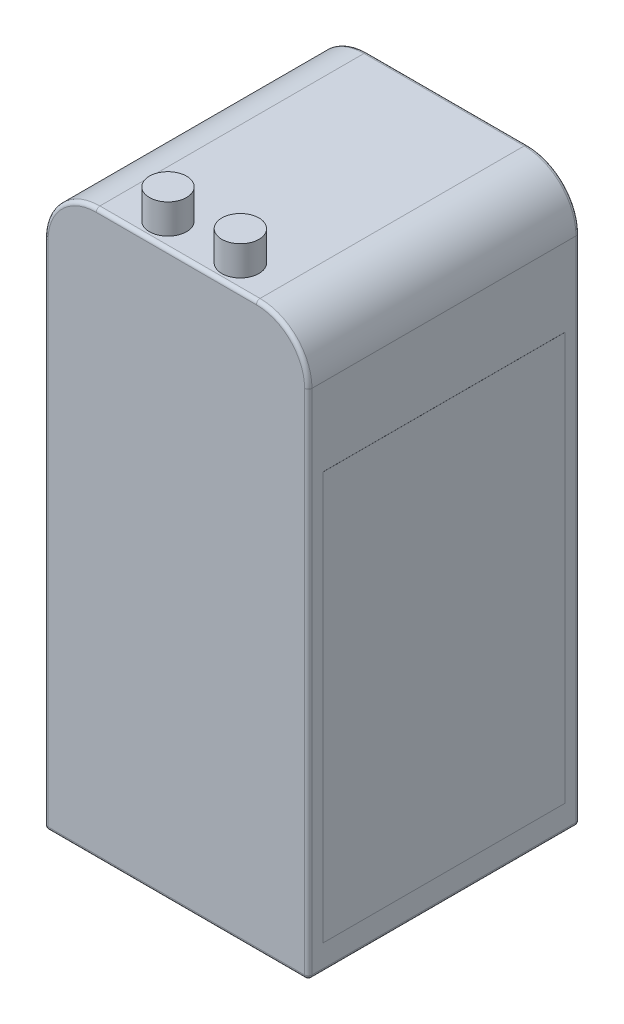
from build123d import *

# Parameters (mm, degrees)
SKETCH1_W             = 35.6
SKETCH1_H             = 36.6
BOSS_EXTRUDE1_DEPTH   = 76
SKETCH2_R             = 2.5
BOSS_EXTRUDE2_DEPTH   = 4
BOSS_EXTRUDE2_2_DEPTH = 4
FILLET1_R             = 7
FILLET2_R             = 0.5
SKETCH3_W             = 32.6
SKETCH3_H             = 55
BOSS_EXTRUDE3_DEPTH   = 0.01


with BuildPart() as part:
    # Sketch1 → Boss-Extrude1 (new body)
    with BuildSketch(Plane(origin=(0, 0, 0), x_dir=(1, 0, 0), z_dir=(0, 1, 0))):
        with Locations((17.8, 18.3)):
            Rectangle(SKETCH1_W, SKETCH1_H)
    extrude(amount=BOSS_EXTRUDE1_DEPTH)

    # Fillet1
    fillet1_edges = [part.edges().sort_by_distance(p)[0] for p in [
        (0, 76, -18.3),
        (35.6, 76, -18.3),
    ]]
    fillet(fillet1_edges, radius=FILLET1_R)

    # Fillet2
    fillet2_edges = [part.edges().sort_by_distance(p)[0] for p in [
        (33.549747468, 73.949747468, 0),
        (35.6, 34.5, 0),
        (17.8, 0, 0),
        (0, 34.5, 0),
        (2.050252532, 73.949747468, 0),
        (17.8, 76, 0),
        (17.8, 0, -36.6),
        (35.6, 34.5, -36.6),
        (33.549747468, 73.949747468, -36.6),
        (17.8, 76, -36.6),
        (2.050252532, 73.949747468, -36.6),
        (0, 34.5, -36.6),
        (0, 0, -18.3),
        (35.6, 0, -18.3),
    ]]
    fillet(fillet2_edges, radius=FILLET2_R)

    # Sketch3 → Boss-Extrude3 (add)
    with BuildSketch(Plane(origin=(35.6, 0, 0), x_dir=(0, 0, -1), z_dir=(1, 0, 0))):
        with Locations((18.3, 31)):
            Rectangle(SKETCH3_W, SKETCH3_H)
    extrude(amount=BOSS_EXTRUDE3_DEPTH)


with BuildPart() as body_2:
    # Sketch2 → Boss-Extrude2 (new body)
    with BuildSketch(Plane(origin=(0, 76, 0), x_dir=(1, 0, 0), z_dir=(0, 1, 0))):
        with Locations((13.354835188, 3.323329695)):
            Circle(SKETCH2_R)
    extrude(amount=BOSS_EXTRUDE2_DEPTH)


with BuildPart() as body_3:
    # Sketch2 → Boss-Extrude2 2 (new body)
    with BuildSketch(Plane(origin=(0, 76, 0), x_dir=(1, 0, 0), z_dir=(0, 1, 0))):
        with Locations((23.120727578, 3.323329695)):
            Circle(SKETCH2_R)
    extrude(amount=BOSS_EXTRUDE2_2_DEPTH)


solid = Compound([part.part, body_2.part, body_3.part])
